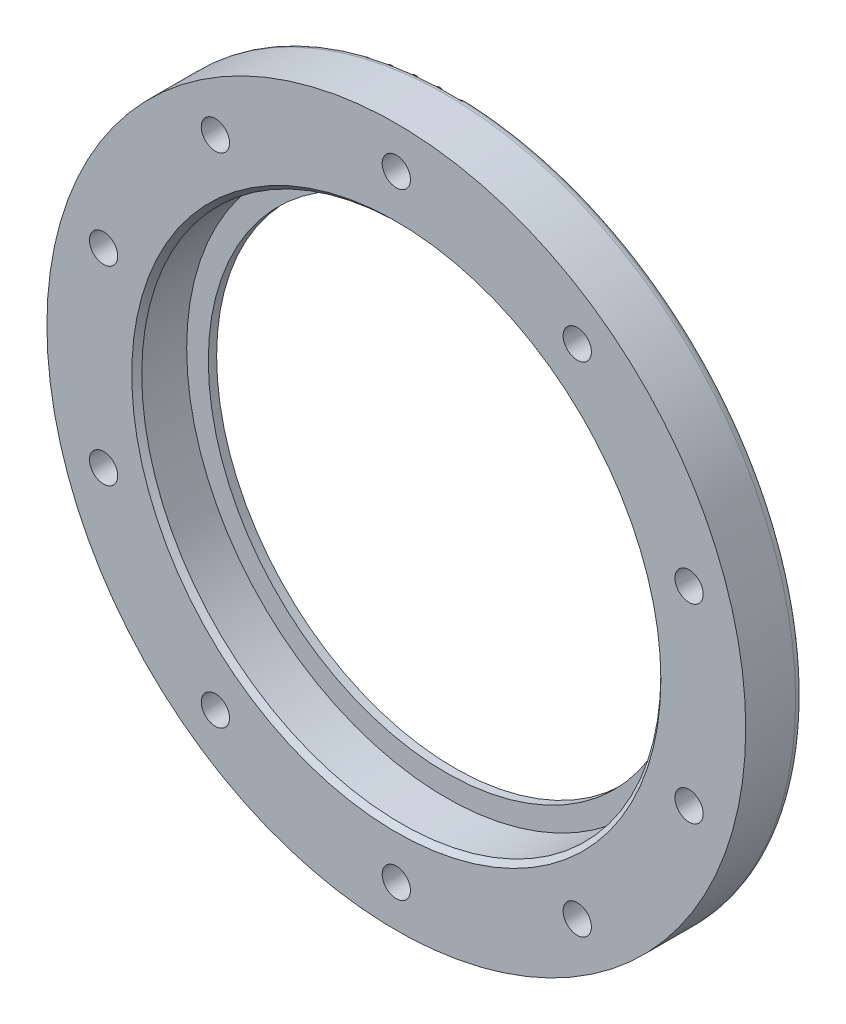
from build123d import *

# Parameters (mm, degrees)
ESQUISSE1_R             = 42
ESQUISSE1_R_2           = 31.2
BOSS_EXTRU_1_DEPTH      = 6
BOSS_EXTRU_2_START      = 1
ESQUISSE2_R             = 42
ESQUISSE2_R_2           = 28.6
BOSS_EXTRU_2_DEPTH      = 1
ESQUISSE5_R             = 1.7
ENL_V_MAT_EXTRU_1_DEPTH = 60.808026217
ESQUISSE6_R             = 3
ENL_V_MAT_EXTRU_2_DEPTH = 3.2
CHANFREIN1_SIZE         = 0.6
CONG_2_R                = 1


with BuildPart() as part:
    # Esquisse1 → Boss.-Extru.1 (new body)
    with BuildSketch(Plane.XY):
        Circle(ESQUISSE1_R)
        Circle(ESQUISSE1_R_2, mode=Mode.SUBTRACT)
    extrude(amount=BOSS_EXTRU_1_DEPTH)

    # Esquisse2 → Boss.-Extru.2 (add)
    with BuildSketch(Plane(origin=(0, 0, 0), x_dir=(-1, 0, 0), z_dir=(0, 0, -1)).offset(BOSS_EXTRU_2_START)):
        Circle(ESQUISSE2_R)
        Circle(ESQUISSE2_R_2, mode=Mode.SUBTRACT)
    extrude(amount=-BOSS_EXTRU_2_DEPTH)

    # Esquisse5 → Enlèv. mat.-Extru.1 (cut, through all)
    with BuildSketch(Plane(origin=(0, 0, -1), x_dir=(-1, 0, 0), z_dir=(0, 0, -1))):
        with Locations((0, 37)):
            Circle(ESQUISSE5_R)
        with Locations((21.748054335, 29.933628792)):
            Circle(ESQUISSE5_R)
        with Locations((35.189091103, 11.433628792)):
            Circle(ESQUISSE5_R)
        with Locations((35.189091103, -11.433628792)):
            Circle(ESQUISSE5_R)
        with Locations((21.748054335, -29.933628792)):
            Circle(ESQUISSE5_R)
        with Locations((0, -37)):
            Circle(ESQUISSE5_R)
        with Locations((-21.748054335, -29.933628792)):
            Circle(ESQUISSE5_R)
        with Locations((-35.189091103, -11.433628792)):
            Circle(ESQUISSE5_R)
        with Locations((-35.189091103, 11.433628792)):
            Circle(ESQUISSE5_R)
        with Locations((-21.748054335, 29.933628792)):
            Circle(ESQUISSE5_R)
    extrude(amount=-ENL_V_MAT_EXTRU_1_DEPTH, mode=Mode.SUBTRACT)

    # Esquisse6 → Enlèv. mat.-Extru.2 (cut)
    with BuildSketch(Plane(origin=(0, 0, -1), x_dir=(-1, 0, 0), z_dir=(0, 0, -1))):
        with Locations((0, 37)):
            Circle(ESQUISSE6_R)
        with Locations((21.748054335, 29.933628792)):
            Circle(ESQUISSE6_R)
        with Locations((35.189091103, 11.433628792)):
            Circle(ESQUISSE6_R)
        with Locations((35.189091103, -11.433628792)):
            Circle(ESQUISSE6_R)
        with Locations((21.748054335, -29.933628792)):
            Circle(ESQUISSE6_R)
        with Locations((0, -37)):
            Circle(ESQUISSE6_R)
        with Locations((-21.748054335, -29.933628792)):
            Circle(ESQUISSE6_R)
        with Locations((-35.189091103, -11.433628792)):
            Circle(ESQUISSE6_R)
        with Locations((-35.189091103, 11.433628792)):
            Circle(ESQUISSE6_R)
        with Locations((-21.748054335, 29.933628792)):
            Circle(ESQUISSE6_R)
    extrude(amount=-ENL_V_MAT_EXTRU_2_DEPTH, mode=Mode.SUBTRACT)

    # Chanfrein1
    chanfrein1_edges = [part.edges().sort_by_distance(p)[0] for p in [
        (-31.2, 0, 6),
    ]]
    chamfer(chanfrein1_edges, length=CHANFREIN1_SIZE)

    # Congé2
    cong_2_edges = [part.edges().sort_by_distance(p)[0] for p in [
        (42, 0, -1),
    ]]
    fillet(cong_2_edges, radius=CONG_2_R - 0.0001)  # a hair under: the kernel refuses the full size


solid = part.part
